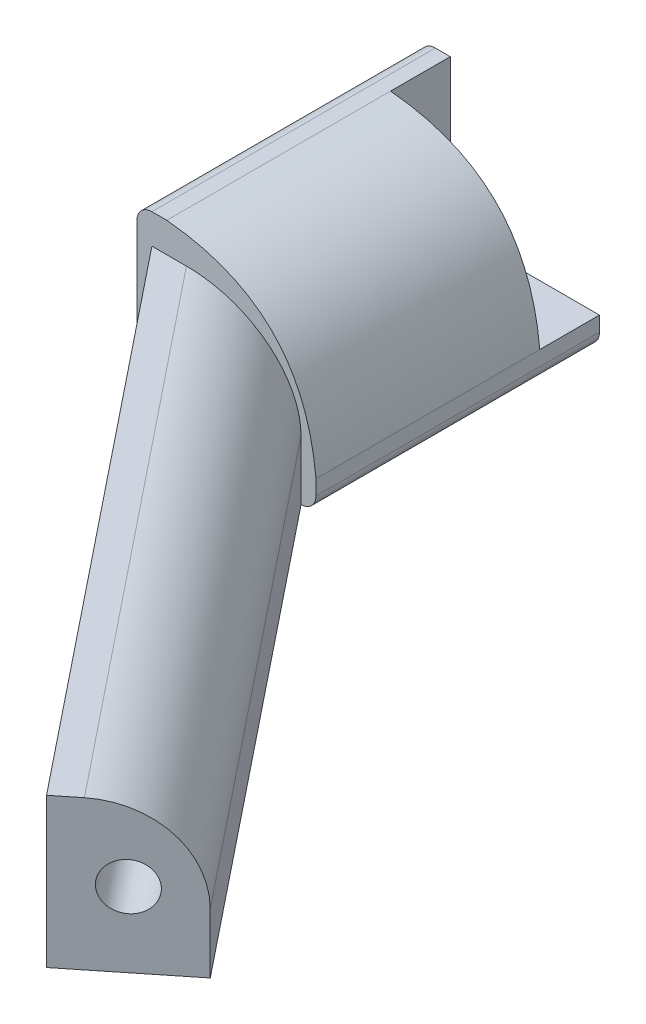
from build123d import *

# Parameters (mm, degrees)
SKETCH1_R                = 3.1115
BOSS_EXTRUDE1_DEPTH      = 3.81
BOSS_EXTRUDE2_DEPTH      = 5.08
BOSS_EXTRUDE2_DEPTH_BACK = 3.81
BOSS_EXTRUDE3_START      = 2.54
SKETCH3_R                = 1.2
BOSS_EXTRUDE3_DEPTH      = 2.54
BOSS_EXTRUDE4_START      = 12.7
SKETCH4_R                = 3.175
BOSS_EXTRUDE4_DEPTH      = 12.7
BOSS_EXTRUDE5_DEPTH      = 12.7
SKETCH7_R                = 3.1115
CUT_EXTRUDE1_DEPTH       = 64.134377028
SKETCH8_R                = 1.999996
CUT_EXTRUDE2_DEPTH       = 6.99999997
FILLET1_R                = 7.62


with BuildPart() as part:
    # Sketch1 → Boss-Extrude1 (new body)
    with BuildSketch(Plane.XY):
        with BuildLine():
            Line((0, 0), (12.7, 0))
            add(Edge.make_bspline(
                [(0, 12.7), (11.620302725, 11.620302725), (12.7, 0)],
                knots=[0, 0, 0, 1, 1, 1], degree=2))
            Line((0, 12.7), (0, 0))
        make_face()
        with Locations(Location((5.08, 5.08, 0), (0, 0, 180))):
            Circle(SKETCH1_R, mode=Mode.SUBTRACT)
    extrude(amount=BOSS_EXTRUDE1_DEPTH)

    # Sketch2 → Boss-Extrude2 (add, two sides: drawn at the far end of the back side and taken through both)
    with BuildSketch(Plane(origin=(0, 0, 0), x_dir=(-1, 0, 0), z_dir=(0, 0, -1)).offset(-BOSS_EXTRUDE2_DEPTH_BACK)):
        with BuildLine():
            Line((0, 12.7), (1.27, 12.7))
            ThreePointArc((1.27, 12.7), (2.168025612, 12.328025612), (2.54, 11.43))
            Line((2.54, 11.43), (2.54, -1.27))
            ThreePointArc((2.54, -1.27), (2.168025612, -2.168025612), (1.27, -2.54))
            Line((1.27, -2.54), (-11.43, -2.54))
            ThreePointArc((-11.43, -2.54), (-12.328025612, -2.168025612), (-12.7, -1.27))
            Line((-12.7, -1.27), (-12.7, 0))
            Line((-12.7, 0), (0, 0))
            Line((0, 0), (0, 12.7))
        make_face()
    extrude(amount=BOSS_EXTRUDE2_DEPTH + BOSS_EXTRUDE2_DEPTH_BACK)

    # Sketch3 → Boss-Extrude3 (add)
    with BuildSketch(Plane.XY.offset(3.81).offset(BOSS_EXTRUDE3_START)):
        with BuildLine():
            Line((-2.54, 11.43), (-2.54, -1.27))
            ThreePointArc((-2.54, -1.27), (-2.168025612, -2.168025612), (-1.27, -2.54))
            Line((-1.27, -2.54), (11.43, -2.54))
            ThreePointArc((11.43, -2.54), (12.328025612, -2.168025612), (12.7, -1.27))
            Line((12.7, -1.27), (12.7, 0))
            add(Edge.make_bspline(
                [(0, 12.7), (11.620302725, 11.620302725), (12.7, 0)],
                knots=[0, 0, 0, 1, 1, 1], degree=2))
            Line((0, 12.7), (-1.27, 12.7))
            ThreePointArc((-1.27, 12.7), (-2.168025612, 12.328025612), (-2.54, 11.43))
        make_face()
        with Locations((5.08, 5.08)):
            Circle(SKETCH3_R, mode=Mode.SUBTRACT)
    extrude(amount=-BOSS_EXTRUDE3_DEPTH)

    # Sketch4 → Boss-Extrude4 (add)
    with BuildSketch(Plane.XY.offset(6.35).offset(BOSS_EXTRUDE4_START)):
        with BuildLine():
            Line((-2.54, 11.43), (-2.54, -1.27))
            ThreePointArc((-2.54, -1.27), (-2.168025612, -2.168025612), (-1.27, -2.54))
            Line((-1.27, -2.54), (11.43, -2.54))
            ThreePointArc((11.43, -2.54), (12.328025612, -2.168025612), (12.7, -1.27))
            Line((12.7, -1.27), (12.7, 0))
            add(Edge.make_bspline(
                [(0, 12.7), (11.620302725, 11.620302725), (12.7, 0)],
                knots=[0, 0, 0, 1, 1, 1], degree=2))
            Line((0, 12.7), (-1.27, 12.7))
            ThreePointArc((-1.27, 12.7), (-2.168025612, 12.328025612), (-2.54, 11.43))
        make_face()
        with Locations((5.08, 5.08)):
            Circle(SKETCH4_R, mode=Mode.SUBTRACT)
    extrude(amount=-BOSS_EXTRUDE4_DEPTH)

    # Sketch5 → Boss-Extrude5 (add)
    with BuildSketch(Plane.XZ.offset(2.54)):
        Polygon((-1.27, 19.05), (34.724533506, 64.010676082), (42.464069123, 57.814573212), (11.43, 19.05), align=None)
    extrude(amount=-BOSS_EXTRUDE5_DEPTH)

    # Sketch7 → Cut-Extrude1 (cut, through all)
    with BuildSketch(Plane.XY.offset(19.05)):
        with Locations(Location((5.08, 5.08, 0), (0, 0, 180))):
            Circle(SKETCH7_R)
    extrude(amount=CUT_EXTRUDE1_DEPTH, mode=Mode.SUBTRACT)

    # Sketch8 → Cut-Extrude2 (cut)
    with BuildSketch(Plane(origin=(44.792641372, 0, 55.95036922), x_dir=(0.7806486106469013, 0, -0.6249701966454584), z_dir=(0.6249701966454583, 0, 0.7806486106469012))):
        with Locations((-7.939987304, 3.81)):
            Circle(SKETCH8_R)
    extrude(amount=-CUT_EXTRUDE2_DEPTH, mode=Mode.SUBTRACT)

    # Fillet1
    # the kernel refuses this fillet: 7.62 mm, written as the material it takes off along each edge
    with BuildSketch(Plane(origin=(54.369751369, 10.16, 72.685929245), x_dir=(0, -1, 0), z_dir=(-0.6249701966454578, 0, -0.7806486106469016))) as fillet1_piece_1_section:
        with BuildLine():
            CenterArc((FILLET1_R, FILLET1_R), FILLET1_R, 180, 90)
            Line((0, FILLET1_R), (0, 0))
            Line((0, 0), (FILLET1_R, 0))
        make_face()
    fillet1_piece_1 = extrude(amount=87.756878503, mode=Mode.PRIVATE)
    fillet1_piece_1 = split(fillet1_piece_1, bisect_by=Plane(origin=(31.089805897, 8.453079593, 19.05), z_dir=(0, 0, 1)), keep=Keep.TOP, mode=Mode.PRIVATE)
    add(fillet1_piece_1, mode=Mode.SUBTRACT)


solid = part.part
